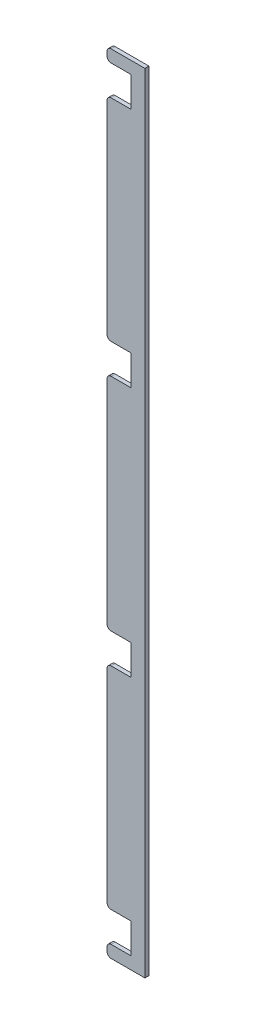
from build123d import *

# Parameters (mm, degrees)
BOSS_EXTRUDE1_DEPTH = 1


with BuildPart() as part:
    # Sketch1 → Boss-Extrude1 (new body)
    with BuildSketch(Plane.XY):
        with BuildLine():
            Line((-4.5, -182.595238095), (0, -182.595238095))
            Line((0, -182.595238095), (0, 13.404761905))
            Line((0, 13.404761905), (-8.4, 13.404761905))
            ThreePointArc((-8.4, 13.404761905), (-9.107106781, 13.111868686), (-9.4, 12.404761905))
            Line((-9.4, 12.404761905), (-9.4, 11.354761905))
            ThreePointArc((-9.4, 11.354761905), (-9.107106781, 10.647655124), (-8.4, 10.354761905))
            Line((-8.4, 10.354761905), (-4.5, 10.354761905))
            Line((-4.5, 10.354761905), (-3.5, 10.354761905))
            Line((-3.5, 10.354761905), (-3.5, 2.854761905))
            Line((-3.5, 2.854761905), (-4.5, 2.854761905))
            Line((-4.5, 2.854761905), (-8.4, 2.854761905))
            ThreePointArc((-8.4, 2.854761905), (-9.107106781, 2.561868686), (-9.4, 1.854761905))
            Line((-9.4, 1.854761905), (-9.4, -48.645238095))
            ThreePointArc((-9.4, -48.645238095), (-9.107106781, -49.352344876), (-8.4, -49.645238095))
            Line((-8.4, -49.645238095), (-4.5, -49.645238095))
            Line((-4.5, -49.645238095), (-3.5, -49.645238095))
            Line((-3.5, -49.645238095), (-3.5, -57.145238095))
            Line((-3.5, -57.145238095), (-4.5, -57.145238095))
            Line((-4.5, -57.145238095), (-8.4, -57.145238095))
            ThreePointArc((-8.4, -57.145238095), (-9.107106781, -57.438131314), (-9.4, -58.145238095))
            Line((-9.4, -58.145238095), (-9.4, -111.045238095))
            ThreePointArc((-9.4, -111.045238095), (-9.107106781, -111.752344876), (-8.4, -112.045238095))
            Line((-8.4, -112.045238095), (-4.5, -112.045238095))
            Line((-4.5, -112.045238095), (-3.5, -112.045238095))
            Line((-3.5, -112.045238095), (-3.5, -119.545238095))
            Line((-3.5, -119.545238095), (-4.5, -119.545238095))
            Line((-4.5, -119.545238095), (-8.4, -119.545238095))
            ThreePointArc((-8.4, -119.545238095), (-9.107106781, -119.838131314), (-9.4, -120.545238095))
            Line((-9.4, -120.545238095), (-9.4, -171.045238095))
            ThreePointArc((-9.4, -171.045238095), (-9.107106781, -171.752344876), (-8.4, -172.045238095))
            Line((-8.4, -172.045238095), (-4.5, -172.045238095))
            Line((-4.5, -172.045238095), (-3.5, -172.045238095))
            Line((-3.5, -172.045238095), (-3.5, -179.545238095))
            Line((-3.5, -179.545238095), (-4.5, -179.545238095))
            Line((-4.5, -179.545238095), (-8.4, -179.545238095))
            ThreePointArc((-8.4, -179.545238095), (-9.107106781, -179.838131314), (-9.4, -180.545238095))
            Line((-9.4, -180.545238095), (-9.4, -181.595238095))
            ThreePointArc((-9.4, -181.595238095), (-9.107106781, -182.302344876), (-8.4, -182.595238095))
            Line((-8.4, -182.595238095), (-4.5, -182.595238095))
        make_face()
    extrude(amount=BOSS_EXTRUDE1_DEPTH)


solid = part.part
